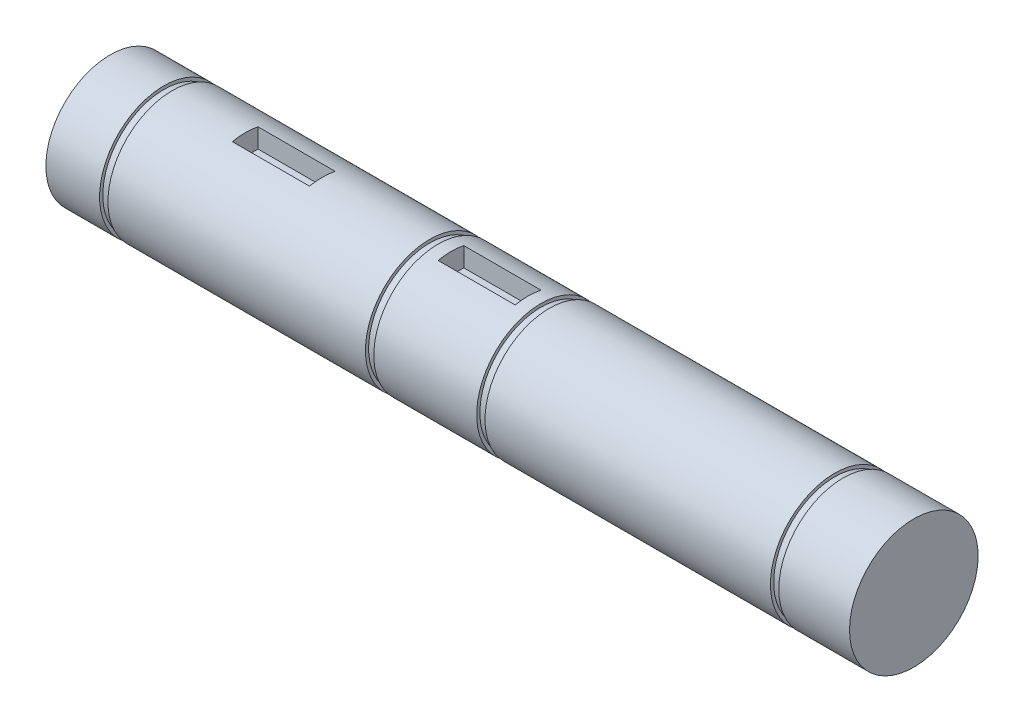
from build123d import *

# Parameters (mm, degrees)
SKETCH1_R           = 10
BOSS_EXTRUDE1_DEPTH = 77.5
SKETCH2_W           = 12
SKETCH2_H           = 4
CUT_EXTRUDE1_DEPTH  = 3.2
SKETCH5_W           = 1.3
SKETCH5_H           = 0.5
SKETCH6_W           = 30
SKETCH6_H           = 20
CUT_EXTRUDE2_DEPTH  = 81.661329025


with BuildPart() as part:
    # Sketch1 → Boss-Extrude1 (new, symmetric)
    with BuildSketch(Plane(origin=(0, 0, 0), x_dir=(0, 0, -1), z_dir=(1, 0, 0))):
        Circle(SKETCH1_R)
    extrude(amount=BOSS_EXTRUDE1_DEPTH, both=True)

    # Sketch2 → Cut-Extrude1 (cut)
    with BuildSketch(Plane(origin=(0, 10, 0), x_dir=(1, 0, 0), z_dir=(0, 1, 0))):
        with Locations((-50.5, 0)):
            Rectangle(SKETCH2_W, SKETCH2_H)
        with Locations((-18.5, 0)):
            Rectangle(SKETCH2_W, SKETCH2_H)
        with Locations((66.5, 0)):
            Rectangle(SKETCH2_W, SKETCH2_H)
    extrude(amount=-CUT_EXTRUDE1_DEPTH, mode=Mode.SUBTRACT)

    # Sketch5 → Cut-Revolve2 (revolve, cut)
    with BuildSketch(Plane.XY):
        with Locations((-27.15, 9.75)):
            Rectangle(SKETCH5_W, SKETCH5_H)
        with Locations((-9.85, 9.75)):
            Rectangle(SKETCH5_W, SKETCH5_H)
        with Locations((75.15, 9.75)):
            Rectangle(SKETCH5_W, SKETCH5_H)
        with Locations((57.85, 9.75)):
            Rectangle(SKETCH5_W, SKETCH5_H)
        with Locations((35.85, 9.75)):
            Rectangle(SKETCH5_W, SKETCH5_H)
        with Locations((-68.5, 9.75)):
            Rectangle(SKETCH5_W, SKETCH5_H)
    revolve(axis=Axis((0, 0, 0), (-1, 0, 0)), mode=Mode.SUBTRACT)

    # Sketch6 → Cut-Extrude2 (cut, through all)
    with BuildSketch(Plane(origin=(0, 10, 0), x_dir=(1, 0, 0), z_dir=(0, 1, 0))):
        with Locations((62.5, 0)):
            Rectangle(SKETCH6_W, SKETCH6_H)
    extrude(amount=-CUT_EXTRUDE2_DEPTH, mode=Mode.SUBTRACT)


solid = part.part
